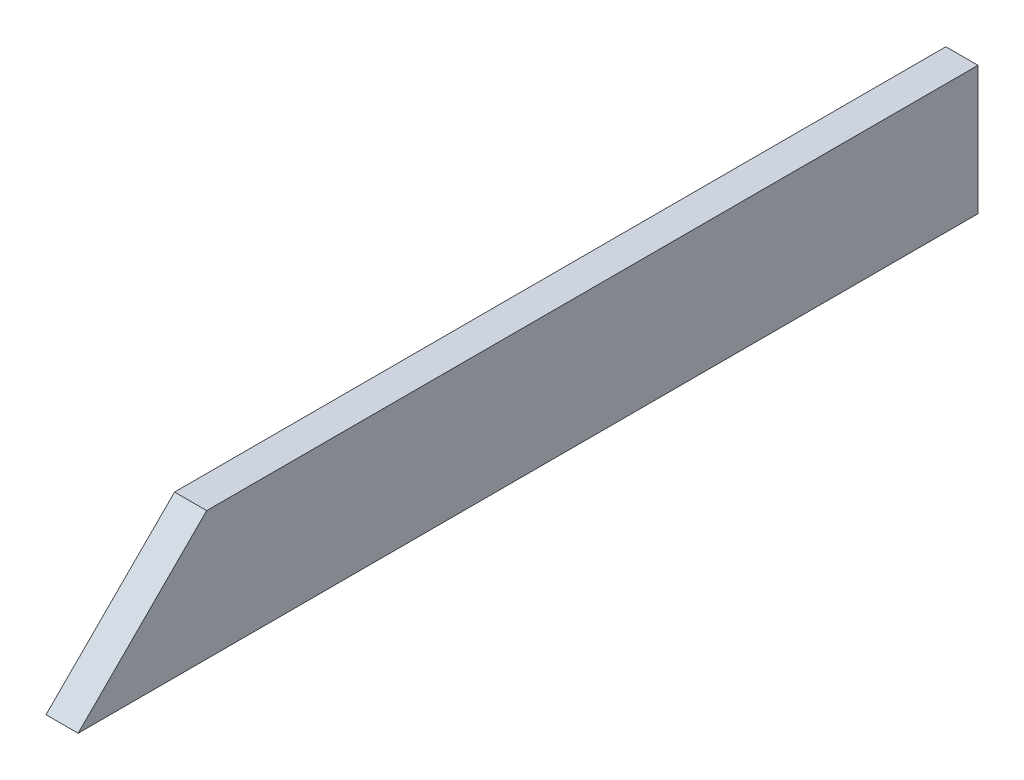
from build123d import *

# Parameters (mm, degrees)
SKETCH1_W               = 355.6
SKETCH1_H               = 50.8
BOSS_EXTRUDE1_DEPTH     = 12.7
CUT_EXTRUDE1_DEPTH      = 181.05357536
CUT_EXTRUDE1_DEPTH_BACK = 181.05357536


with BuildPart() as part:
    # Sketch1 → Boss-Extrude1 (new body)
    with BuildSketch(Plane(origin=(0, 0, 0), x_dir=(0, 0, -1), z_dir=(1, 0, 0))):
        Rectangle(SKETCH1_W, SKETCH1_H)
    extrude(amount=BOSS_EXTRUDE1_DEPTH)

    # Sketch2 → Cut-Extrude1 (cut, two sides: drawn at the far end of the back side and taken through both)
    with BuildSketch(Plane(origin=(12.7, 0, 0), x_dir=(0, 0, -1), z_dir=(1, 0, 0)).offset(-CUT_EXTRUDE1_DEPTH_BACK)):
        Polygon((-692.871067812, -540.471067812), (-177.8, -25.4), (-127, 25.4), (388.071067812, 540.471067812), (-642.071067812, 1570.613203436), (-1723.013203436, 489.671067812), align=None)
    extrude(amount=CUT_EXTRUDE1_DEPTH + CUT_EXTRUDE1_DEPTH_BACK, mode=Mode.SUBTRACT)


solid = part.part
